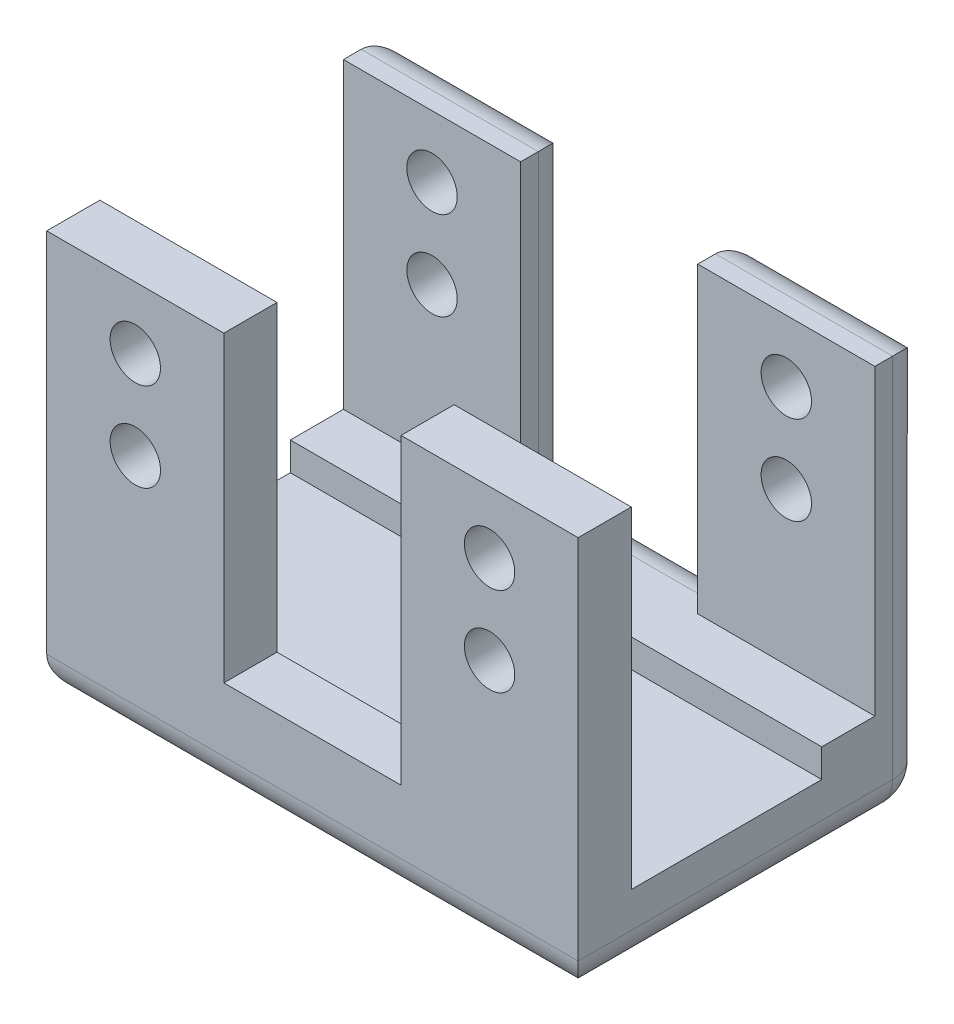
from build123d import *

# Parameters (mm, degrees)
SKETCH1_W           = 30
SKETCH1_H           = 19.75
BOSS_EXTRUDE1_DEPTH = 4
SKETCH2_W           = 30
SKETCH2_H           = 6
BOSS_EXTRUDE2_DEPTH = 1.601
SKETCH3_W           = 10
SKETCH3_H           = 3
BOSS_EXTRUDE3_DEPTH = 18.7
SKETCH4_W           = 10
SKETCH4_H           = 3
BOSS_EXTRUDE4_DEPTH = 17.099
SKETCH5_W           = 10
SKETCH5_H           = 3
BOSS_EXTRUDE5_DEPTH = 1.601
FILLET1_R           = 2
CUT_EXTRUDE1_REACH  = 43.181
SKETCH6_R           = 1.4224
CUT_EXTRUDE2_REACH  = 43.181
SKETCH7_R           = 1.4224


with BuildPart() as part:
    # Sketch1 → Boss-Extrude1 (new body)
    with BuildSketch(Plane(origin=(0, 0, 0), x_dir=(1, 0, 0), z_dir=(0, 1, 0))):
        with Locations((15, 9.875)):
            Rectangle(SKETCH1_W, SKETCH1_H)
    extrude(amount=BOSS_EXTRUDE1_DEPTH)

    # Sketch2 → Boss-Extrude2 (add)
    with BuildSketch(Plane(origin=(0, 4, 0), x_dir=(1, 0, 0), z_dir=(0, 1, 0))):
        with Locations((15, 16.75)):
            Rectangle(SKETCH2_W, SKETCH2_H)
    extrude(amount=BOSS_EXTRUDE2_DEPTH)

    # Sketch3 → Boss-Extrude3 (add)
    with BuildSketch(Plane(origin=(0, 4, 0), x_dir=(1, 0, 0), z_dir=(0, 1, 0))):
        with Locations((5, 1.5)):
            Rectangle(SKETCH3_W, SKETCH3_H)
        with Locations((25, 1.5)):
            Rectangle(SKETCH3_W, SKETCH3_H)
    extrude(amount=BOSS_EXTRUDE3_DEPTH)

    # Sketch4 → Boss-Extrude4 (add)
    with BuildSketch(Plane(origin=(0, 5.601, 0), x_dir=(1, 0, 0), z_dir=(0, 1, 0))):
        with Locations((5, 18.25)):
            Rectangle(SKETCH4_W, SKETCH4_H)
        with Locations((25, 18.25)):
            Rectangle(SKETCH4_W, SKETCH4_H)
    extrude(amount=BOSS_EXTRUDE4_DEPTH)

    # Sketch5 → Boss-Extrude5 (add)
    with BuildSketch(Plane(origin=(0, 4, 0), x_dir=(1, 0, 0), z_dir=(0, 1, 0))):
        with Locations((15, 1.5)):
            Rectangle(SKETCH5_W, SKETCH5_H)
    extrude(amount=BOSS_EXTRUDE5_DEPTH)

    # Fillet1
    fillet1_edges = [part.edges().sort_by_distance(p)[0] for p in [
        (30, 11.35, -19.75),
        (25, 22.7, -19.75),
        (20, 14.1505, -19.75),
        (15, 5.601, -19.75),
        (10, 14.1505, -19.75),
        (5, 22.7, -19.75),
        (0, 11.35, -19.75),
        (15, 0, 0),
        (30, 0, -9.875),
        (15, 0, -19.75),
        (0, 0, -9.875),
    ]]
    fillet(fillet1_edges, radius=FILLET1_R)

    # Sketch6 → Cut-Extrude1 (cut, up to next)
    with BuildSketch(Plane.XY.offset(-16.75), mode=Mode.PRIVATE) as cut_extrude1_sk1:
        with Locations((5, 19.2)):
            Circle(SKETCH6_R)
    cut_extrude1_tool1 = extrude(cut_extrude1_sk1.sketch, amount=-CUT_EXTRUDE1_REACH, mode=Mode.PRIVATE) & part.part
    # Sketch6 → Cut-Extrude1 (cut, up to next)
    with BuildSketch(Plane.XY.offset(-16.75), mode=Mode.PRIVATE) as cut_extrude1_sk2:
        with Locations((25, 19.2)):
            Circle(SKETCH6_R)
    cut_extrude1_tool2 = extrude(cut_extrude1_sk2.sketch, amount=-CUT_EXTRUDE1_REACH, mode=Mode.PRIVATE) & part.part
    # Sketch6 → Cut-Extrude1 (cut, up to next)
    with BuildSketch(Plane.XY.offset(-16.75), mode=Mode.PRIVATE) as cut_extrude1_sk3:
        with Locations((5, 14.2)):
            Circle(SKETCH6_R)
    cut_extrude1_tool3 = extrude(cut_extrude1_sk3.sketch, amount=-CUT_EXTRUDE1_REACH, mode=Mode.PRIVATE) & part.part
    # Sketch6 → Cut-Extrude1 (cut, up to next)
    with BuildSketch(Plane.XY.offset(-16.75), mode=Mode.PRIVATE) as cut_extrude1_sk4:
        with Locations((25, 14.2)):
            Circle(SKETCH6_R)
    cut_extrude1_tool4 = extrude(cut_extrude1_sk4.sketch, amount=-CUT_EXTRUDE1_REACH, mode=Mode.PRIVATE) & part.part
    add(cut_extrude1_tool1.solids().sort_by_distance((5, 19.2, -16.75))[0], mode=Mode.SUBTRACT)
    add(cut_extrude1_tool2.solids().sort_by_distance((25, 19.2, -16.75))[0], mode=Mode.SUBTRACT)
    add(cut_extrude1_tool3.solids().sort_by_distance((5, 14.2, -16.75))[0], mode=Mode.SUBTRACT)
    add(cut_extrude1_tool4.solids().sort_by_distance((25, 14.2, -16.75))[0], mode=Mode.SUBTRACT)

    # Sketch7 → Cut-Extrude2 (cut, up to next)
    with BuildSketch(Plane(origin=(0, 0, -3), x_dir=(-1, 0, 0), z_dir=(0, 0, -1)), mode=Mode.PRIVATE) as cut_extrude2_sk1:
        with Locations((-25, 19.2)):
            Circle(SKETCH7_R)
    cut_extrude2_tool1 = extrude(cut_extrude2_sk1.sketch, amount=-CUT_EXTRUDE2_REACH, mode=Mode.PRIVATE) & part.part
    # Sketch7 → Cut-Extrude2 (cut, up to next)
    with BuildSketch(Plane(origin=(0, 0, -3), x_dir=(-1, 0, 0), z_dir=(0, 0, -1)), mode=Mode.PRIVATE) as cut_extrude2_sk2:
        with Locations((-5, 19.2)):
            Circle(SKETCH7_R)
    cut_extrude2_tool2 = extrude(cut_extrude2_sk2.sketch, amount=-CUT_EXTRUDE2_REACH, mode=Mode.PRIVATE) & part.part
    # Sketch7 → Cut-Extrude2 (cut, up to next)
    with BuildSketch(Plane(origin=(0, 0, -3), x_dir=(-1, 0, 0), z_dir=(0, 0, -1)), mode=Mode.PRIVATE) as cut_extrude2_sk3:
        with Locations((-5, 14.2)):
            Circle(SKETCH7_R)
    cut_extrude2_tool3 = extrude(cut_extrude2_sk3.sketch, amount=-CUT_EXTRUDE2_REACH, mode=Mode.PRIVATE) & part.part
    # Sketch7 → Cut-Extrude2 (cut, up to next)
    with BuildSketch(Plane(origin=(0, 0, -3), x_dir=(-1, 0, 0), z_dir=(0, 0, -1)), mode=Mode.PRIVATE) as cut_extrude2_sk4:
        with Locations((-25, 14.2)):
            Circle(SKETCH7_R)
    cut_extrude2_tool4 = extrude(cut_extrude2_sk4.sketch, amount=-CUT_EXTRUDE2_REACH, mode=Mode.PRIVATE) & part.part
    add(cut_extrude2_tool1.solids().sort_by_distance((25, 19.2, -3))[0], mode=Mode.SUBTRACT)
    add(cut_extrude2_tool2.solids().sort_by_distance((5, 19.2, -3))[0], mode=Mode.SUBTRACT)
    add(cut_extrude2_tool3.solids().sort_by_distance((5, 14.2, -3))[0], mode=Mode.SUBTRACT)
    add(cut_extrude2_tool4.solids().sort_by_distance((25, 14.2, -3))[0], mode=Mode.SUBTRACT)


solid = part.part
